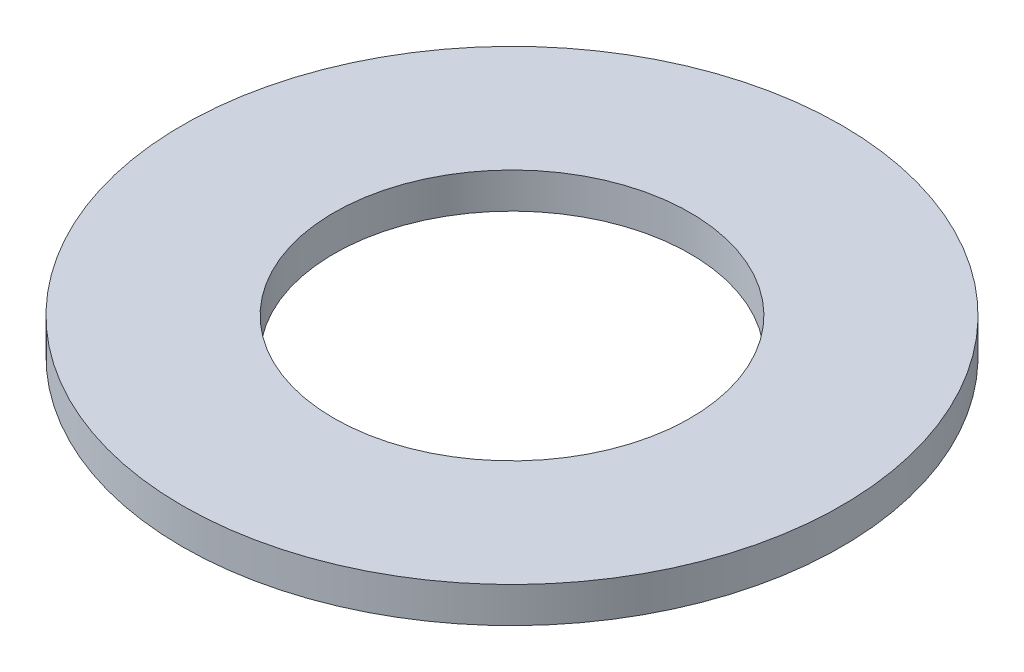
from build123d import *

# Parameters (mm, degrees)
SKETCH1_R           = 92.5
BOSS_EXTRUDE1_DEPTH = 10
SKETCH2_R           = 50
CUT_EXTRUDE1_DEPTH  = 132.196417634


with BuildPart() as part:
    # Sketch1 → Boss-Extrude1 (new body)
    with BuildSketch(Plane(origin=(0, 0, 0), x_dir=(1, 0, 0), z_dir=(0, 1, 0))):
        Circle(SKETCH1_R)
    extrude(amount=BOSS_EXTRUDE1_DEPTH)

    # Sketch2 → Cut-Extrude1 (cut, through all)
    with BuildSketch(Plane(origin=(0, 0, 0), x_dir=(1, 0, 0), z_dir=(0, 1, 0))):
        Circle(SKETCH2_R)
    extrude(amount=CUT_EXTRUDE1_DEPTH, mode=Mode.SUBTRACT)


solid = part.part
